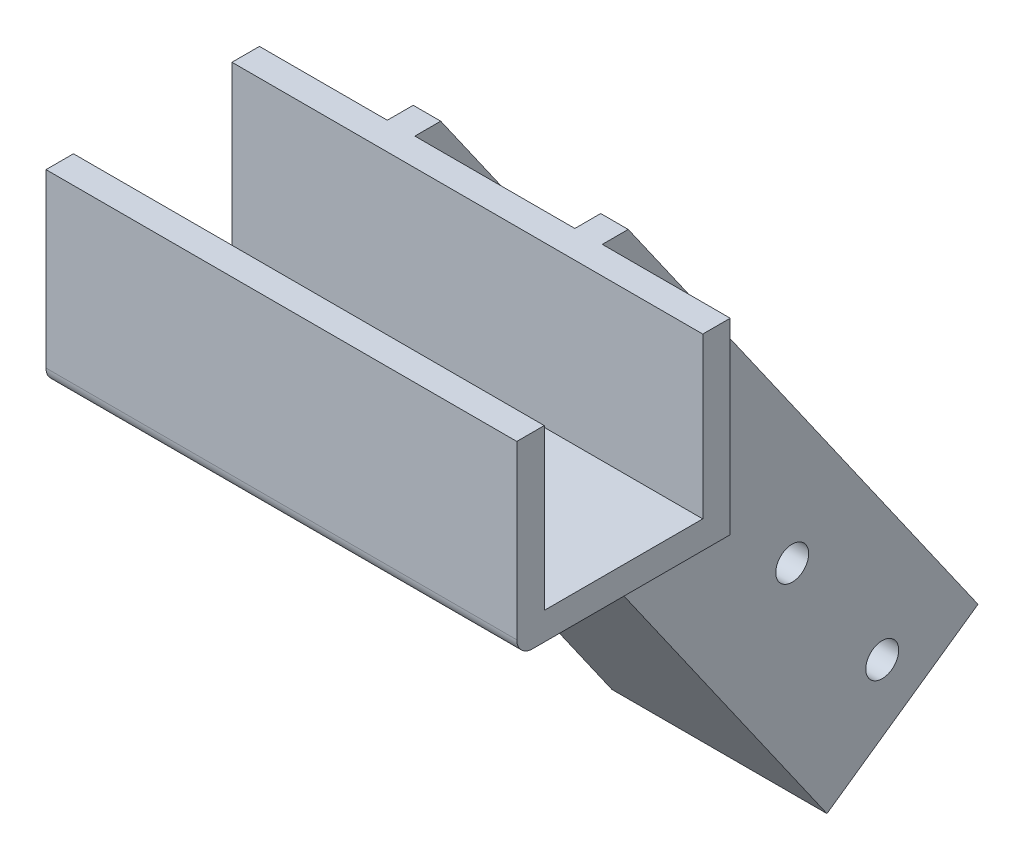
from build123d import *

# Parameters (mm, degrees)
SKETCH1_W           = 27.2
SKETCH1_H           = 23.9
BOSS_EXTRUDE1_DEPTH = 30
SHELL1_T            = -3.5
BOSS_EXTRUDE2_DEPTH = 13.7
SHELL3_START        = -10.194612797
SHELL3_DEPTH        = 20.389225594
FILLET2_R           = 2
SKETCH3_R           = 2.1
CUT_EXTRUDE1_DEPTH  = 100.698379758
FILLET3_R           = 10
SKETCH4_W           = 27.4
SKETCH4_H           = 4.712888426
CUT_EXTRUDE2_DEPTH  = 89.262138497


# Read off the part's stored shape, not the designer's step: Shell3
with BuildPart() as part:
    # Sketch1 → Boss-Extrude1 (new, symmetric)
    with BuildSketch(Plane(origin=(0, 0, 0), x_dir=(0, 0, -1), z_dir=(1, 0, 0))):
        Rectangle(SKETCH1_W, SKETCH1_H)
    extrude(amount=BOSS_EXTRUDE1_DEPTH, both=True)

    # Shell1
    shell1_openings = [part.faces().sort_by_distance(p)[0] for p in [
        (30, 0, 0),
        (-30, 0, 0),
        (0, 11.95, 0),
    ]]
    offset(amount=SHELL1_T, openings=shell1_openings, kind=Kind.INTERSECTION)

    # Sketch2 → Boss-Extrude2 (add, symmetric)
    with BuildSketch(Plane(origin=(0, 0, 0), x_dir=(0, 0, -1), z_dir=(1, 0, 0))):
        Polygon((4.94675733, -11.95), (42.229225693, -65.194882879), (61.479298734, -51.715836625), (13.6, 16.662888426), (10.1, 16.662888426), (10.1, 11.95), (13.6, 11.95), (13.6, -11.95), align=None)
    extrude(amount=BOSS_EXTRUDE2_DEPTH, both=True)

    # Shell3 outline → Shell3 (cut)
    with BuildSketch(Plane.YZ.offset(SHELL3_START)):
        Polygon((13.157501223, -16.054498544), (13.157501223, -13.605387203), (-11.955387203, -13.605387203), (-11.955387203, -9.229817112), (-63.184275379, -45.100670786), (-51.715836625, -61.479298734), align=None)
    extrude(amount=SHELL3_DEPTH, mode=Mode.SUBTRACT)

    # Fillet2
    fillet2_edges = [part.edges().sort_by_distance(p)[0] for p in [
        (0, -11.95, 13.6),
    ]]
    fillet(fillet2_edges, radius=FILLET2_R)

    # Sketch3 → Cut-Extrude1 (cut, through all)
    with BuildSketch(Plane(origin=(13.7, 0, 0), x_dir=(0, 0, -1), z_dir=(1, 0, 0))):
        with Locations((49.272743236, -51.717536678)):
            Circle(SKETCH3_R)
        with Locations((37.801214509, -35.334495792)):
            Circle(SKETCH3_R)
        with Locations((26.329685782, -18.951454906)):
            Circle(SKETCH3_R)
    extrude(amount=-CUT_EXTRUDE1_DEPTH, mode=Mode.SUBTRACT)

    # Fillet3
    fillet3_edges = [part.edges().sort_by_distance(p)[0] for p in [
        (0, -11.95, -4.94675733),
    ]]
    fillet(fillet3_edges, radius=FILLET3_R)

    # Sketch4 → Cut-Extrude2 (cut, through all)
    with BuildSketch(Plane.XY.offset(-10.1)):
        with Locations((0, 14.306444213)):
            Rectangle(SKETCH4_W, SKETCH4_H)
    extrude(amount=-CUT_EXTRUDE2_DEPTH, mode=Mode.SUBTRACT)


solid = part.part
